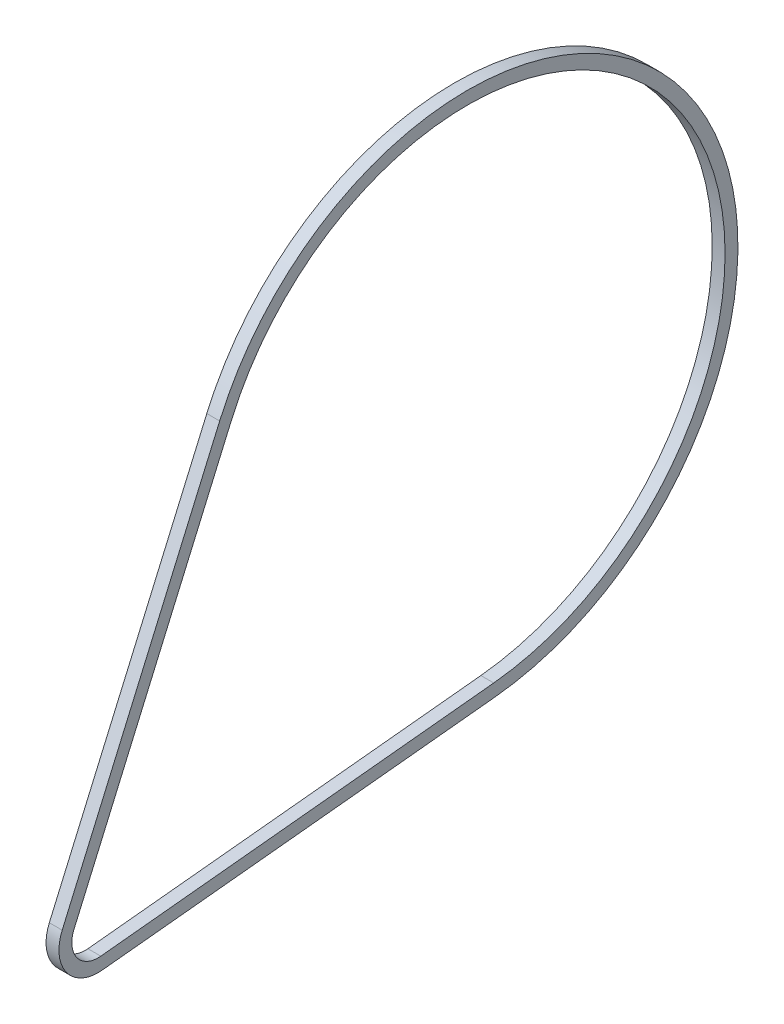
from build123d import *

# Parameters (mm, degrees)
BOSS_EXTRUDE1_DEPTH = 5


with BuildPart() as part:
    # Sketch1 → Boss-Extrude1 (new body)
    with BuildSketch(Plane(origin=(0, 0, 0), x_dir=(0, 0, -1), z_dir=(1, 0, 0))):
        with BuildLine():
            Line((91.68301773, -16.353136123), (244.301986165, -0.771228641))
            ThreePointArc((244.301986165, -0.771228641), (318.403925699, 165.650374119), (137.342850629, 145.547279763))
            Line((137.342850629, 145.547279763), (76.180253092, 4.854415589))
            ThreePointArc((76.180253092, 4.854415589), (77.851096391, -10.194247003), (91.68301773, -16.353136123))
        make_face()
        with BuildLine():
            Line((80.765701246, 2.861010155), (141.928298784, 143.553874329))
            ThreePointArc((141.928298784, 143.553874329), (314.367417897, 162.699678477), (243.794142151, 4.202913944))
            Line((243.794142151, 4.202913944), (91.175173716, -11.378993538))
            ThreePointArc((91.175173716, -11.378993538), (81.887604193, -7.243551361), (80.765701246, 2.861010155))
        make_face(mode=Mode.SUBTRACT)
    extrude(amount=BOSS_EXTRUDE1_DEPTH)


solid = part.part
